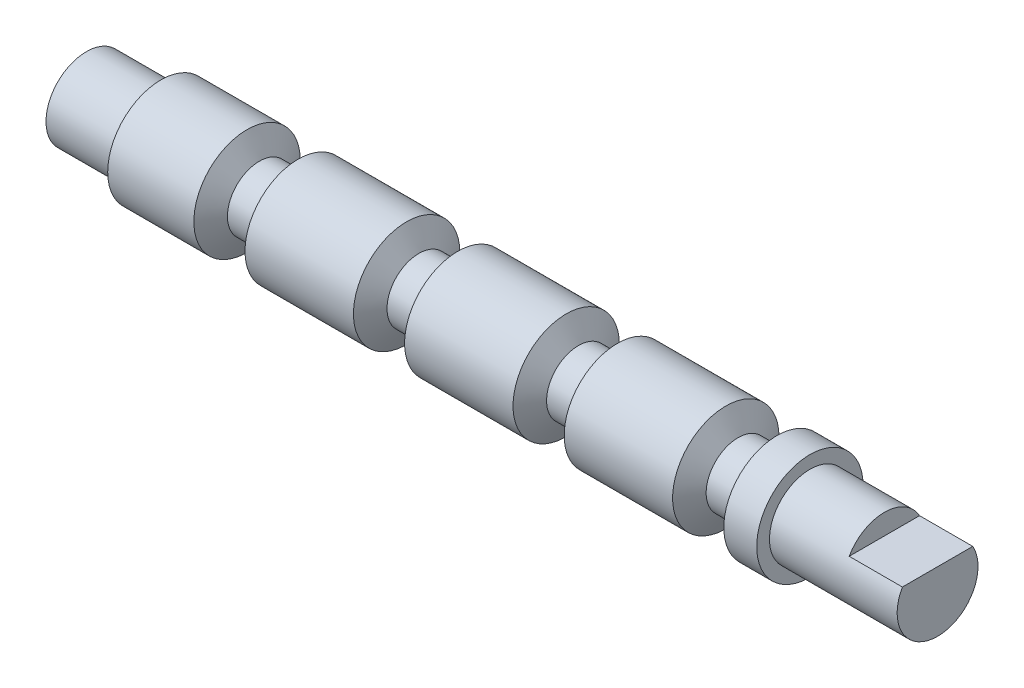
from build123d import *

# Parameters (mm, degrees)
CUT_EXTRUDE2_START = -7
SKETCH4_R          = 5
SKETCH4_R_2        = 3.8
CUT_EXTRUDE2_DEPTH = 7
SKETCH3_R          = 5
SKETCH3_R_2        = 3.8
CUT_EXTRUDE4_DEPTH = 12
CUT_EXTRUDE5_DEPTH = 5


with BuildPart() as part:
    # Sketch2 → Revolve1 (revolve)
    with BuildSketch(Plane(origin=(0, 0, 0), x_dir=(1, 0, 0), z_dir=(0, 1, 0))):
        Polygon((40, -5), (-40, -5), (-40, 0), (-30.049059985, 0), (-24.904700538, 0), (-23.75, -2), (-21.25, -2), (-20.095299462, 0), (-9.904700538, 0), (-8.75, -2), (-6.25, -2), (-5.095299462, 0), (5.095299462, 0), (6.25, -2), (8.75, -2), (9.904700538, 0), (20.095299462, 0), (21.25, -2), (23.75, -2), (24.904700538, 0), (30.049059985, 0), (40, 0), align=None)
    revolve(axis=Axis((40, 0, 5), (-1, 0, 0)))

    # Sketch4 → Cut-Extrude2 (cut)
    with BuildSketch(Plane.ZY.offset(40).offset(CUT_EXTRUDE2_START)):
        with Locations((5, 0)):
            Circle(SKETCH4_R)
        with Locations((5, 0)):
            Circle(SKETCH4_R_2, mode=Mode.SUBTRACT)
    extrude(amount=CUT_EXTRUDE2_DEPTH, mode=Mode.SUBTRACT)

    # Sketch3 → Cut-Extrude4 (cut)
    with BuildSketch(Plane(origin=(40, 0, 0), x_dir=(0, 0, -1), z_dir=(1, 0, 0))):
        with Locations((-5, 0)):
            Circle(SKETCH3_R)
        with Locations((-5, 0)):
            Circle(SKETCH3_R_2, mode=Mode.SUBTRACT)
    extrude(amount=-CUT_EXTRUDE4_DEPTH, mode=Mode.SUBTRACT)

    # Sketch5 → Cut-Extrude5 (cut)
    with BuildSketch(Plane(origin=(40, 0, 0), x_dir=(0, 0, -1), z_dir=(1, 0, 0))):
        with BuildLine():
            Line((-8.307550461, 1.870858078), (-1.692449539, 1.870858078))
            ThreePointArc((-1.692449539, 1.870858078), (-5, 3.8), (-8.307550461, 1.870858078))
        make_face()
    extrude(amount=-CUT_EXTRUDE5_DEPTH, mode=Mode.SUBTRACT)


solid = part.part
